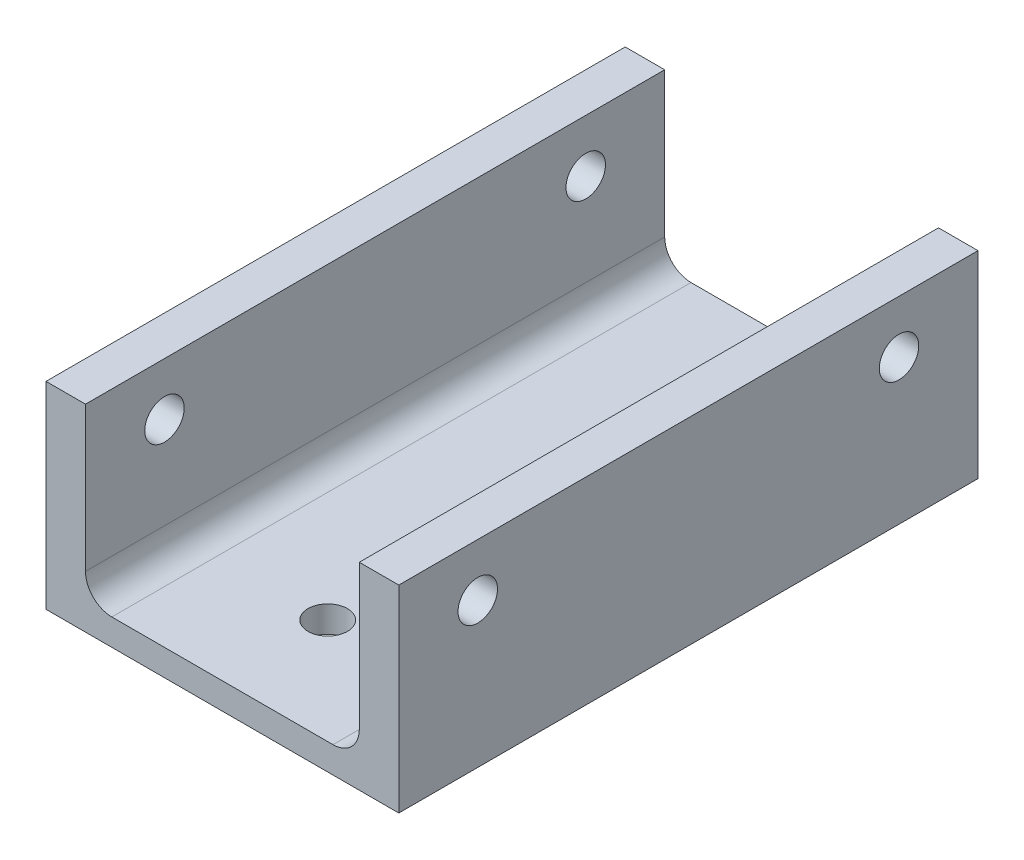
from build123d import *

# Parameters (mm, degrees)
BOSS_EXTRUDE1_DEPTH = 44
FILLET1_R           = 2
SKETCH3_R           = 1.5
CUT_EXTRUDE1_DEPTH  = 30
SKETCH4_R           = 1.5
CUT_EXTRUDE2_DEPTH  = 30


with BuildPart() as part:
    # Sketch2 → Boss-Extrude1 (new body)
    with BuildSketch(Plane.XY):
        Polygon((23.8, 15), (26.8, 15), (26.8, 0), (0, 0), (0, 15), (3, 15), (3, 2), (23.8, 2), align=None)
    extrude(amount=BOSS_EXTRUDE1_DEPTH)

    # Fillet1
    fillet1_edges = [part.edges().sort_by_distance(p)[0] for p in [
        (23.8, 2, 22),
        (3, 2, 22),
    ]]
    fillet(fillet1_edges, radius=FILLET1_R)

    # Sketch3 → Cut-Extrude1 (cut)
    with BuildSketch(Plane.XZ):
        with Locations((13.4, 36)):
            Circle(SKETCH3_R)
        with Locations((13.4, 8)):
            Circle(SKETCH3_R)
    extrude(amount=-CUT_EXTRUDE1_DEPTH, mode=Mode.SUBTRACT)

    # Sketch4 → Cut-Extrude2 (cut)
    with BuildSketch(Plane.ZY):
        with Locations((6, 11)):
            Circle(SKETCH4_R)
        with Locations((38, 11)):
            Circle(SKETCH4_R)
    extrude(amount=-CUT_EXTRUDE2_DEPTH, mode=Mode.SUBTRACT)


solid = part.part
